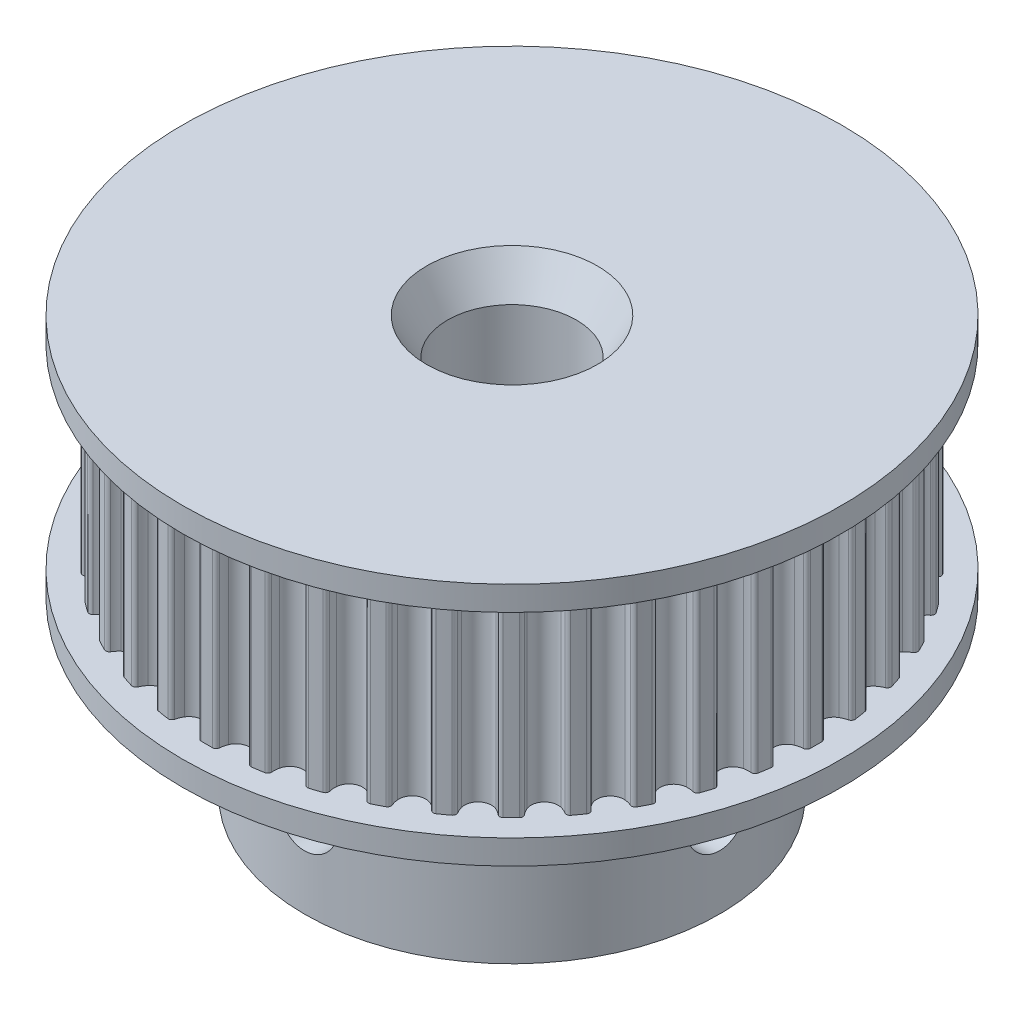
from build123d import *

# Parameters (mm, degrees)
SKETCH1_R               = 13.5
BOSS_EXTRUDE1_DEPTH     = 10
SKETCH6_R               = 8.5
BOSS_EXTRUDE2_DEPTH     = 7
CUT_EXTRUDE3_DEPTH      = 22.552262062
CUT_EXTRUDE3_DEPTH_BACK = 22.552262062
SKETCH4_R               = 2.64
CUT_EXTRUDE1_DEPTH      = 8
CIRPATTERN1_COUNT       = 40
CUT_EXTRUDE4_DEPTH      = 10
CUT_EXTRUDE4_DEPTH_BACK = 22.552262062
SKETCH7_R               = 1.25
CUT_EXTRUDE5_DEPTH      = 10
CUT_EXTRUDE5_DEPTH_BACK = 22.552262062
SKETCH8_R               = 1.25


with BuildPart() as part:
    # Sketch1 → Boss-Extrude1 (new body)
    with BuildSketch(Plane(origin=(0, 0, 0), x_dir=(1, 0, 0), z_dir=(0, 1, 0))):
        with Locations(Location((0, 0, 0), (0, 0, 270))):
            Circle(SKETCH1_R)
    extrude(amount=BOSS_EXTRUDE1_DEPTH)

    # Sketch6 → Boss-Extrude2 (add)
    with BuildSketch(Plane(origin=(0, 0, 0), x_dir=(1, 0, 0), z_dir=(0, 1, 0))):
        with Locations(Location((0, 0, 0), (0, 0, 270))):
            Circle(SKETCH6_R)
    extrude(amount=-BOSS_EXTRUDE2_DEPTH)

    # Sketch4 → Cut-Extrude3 (cut, two sides: drawn at the far end of the back side and taken through both)
    with BuildSketch(Plane(origin=(0, 0, 0), x_dir=(1, 0, 0), z_dir=(0, 1, 0)).offset(-CUT_EXTRUDE3_DEPTH_BACK)):
        with Locations(Location((0, 0, 0), (0, 0, 270))):
            Circle(SKETCH4_R)
    extrude(amount=CUT_EXTRUDE3_DEPTH + CUT_EXTRUDE3_DEPTH_BACK, mode=Mode.SUBTRACT)

    # Sketch2 → Cut-Extrude1 (cut)
    with BuildSketch(Plane(origin=(0, 1, 0), x_dir=(1, 0, 0), z_dir=(0, 1, 0))):
        with BuildLine():
            Line((0, 12.48), (0, 13.826261798))
            ThreePointArc((0, 13.826261798), (1.1066884, 13.781899583), (2.206275075, 13.649097612))
            Line((2.206275075, 13.649097612), (1.99145028, 12.320086273))
            ThreePointArc((1.99145028, 12.320086273), (1.866164383, 12.339685186), (1.740685811, 12.358010071))
            ThreePointArc((1.740685811, 12.358010071), (1.63501831, 12.33324281), (1.573716318, 12.243682194))
            ThreePointArc((1.573716318, 12.243682194), (1.528147474, 12.09934832), (1.461317373, 11.963545064))
            ThreePointArc((1.461317373, 11.963545064), (0.938898389, 11.692363739), (0.46644624, 12.04343335))
            ThreePointArc((0.46644624, 12.04343335), (0.422142779, 12.188160646), (0.400189386, 12.337916566))
            ThreePointArc((0.400189386, 12.337916566), (0.3539642, 12.436111628), (0.253602825, 12.477423036))
            ThreePointArc((0.253602825, 12.477423036), (0.126807959, 12.479355742), (0, 12.48))
        make_face()
    cut_extrude1 = extrude(amount=CUT_EXTRUDE1_DEPTH, mode=Mode.SUBTRACT)

    # CirPattern1: Cut-Extrude1 ×40 about axis
    cirpattern1_axis = Axis((0, 0, 0), (0, 1, 0))
    for i in range(1, CIRPATTERN1_COUNT):
        add(cut_extrude1.rotate(cirpattern1_axis, i * 360 / CIRPATTERN1_COUNT), mode=Mode.SUBTRACT)

    # Sketch5 → Cut-Revolve1 (revolve, cut)
    with BuildSketch(Plane.XY, mode=Mode.PRIVATE) as cut_revolve1_sk:
        Polygon((-3.5, 10), (0, 10), (0, 6.124394972), (-1.262418394, 6.124394972), align=None)
        Polygon((-3.5, -7), (0, -7), (0, -4.128474964), (-0.628474964, -4.128474964), align=None)
    revolve(cut_revolve1_sk.sketch.rotate(Axis((0, 10, 0), (0, -1, 0)), 90), axis=Axis((0, 10, 0), (0, -1, 0)), mode=Mode.SUBTRACT)

    # Sketch7 → Cut-Extrude4 (cut, two sides: drawn at the far end of the back side and taken through both)
    with BuildSketch(Plane.XY.offset(-CUT_EXTRUDE4_DEPTH_BACK)):
        with Locations(Location((0, -3.5, 0), (0, 0, 180))):
            Circle(SKETCH7_R)
    extrude(amount=CUT_EXTRUDE4_DEPTH + CUT_EXTRUDE4_DEPTH_BACK, mode=Mode.SUBTRACT)

    # Sketch8 → Cut-Extrude5 (cut, two sides: drawn at the far end of the back side and taken through both)
    with BuildSketch(Plane(origin=(0, 0, 0), x_dir=(0, 0, -1), z_dir=(1, 0, 0)).offset(-CUT_EXTRUDE5_DEPTH_BACK)):
        with Locations(Location((0, -3.5, 0), (0, 0, 180))):
            Circle(SKETCH8_R)
    extrude(amount=CUT_EXTRUDE5_DEPTH + CUT_EXTRUDE5_DEPTH_BACK, mode=Mode.SUBTRACT)


solid = part.part
